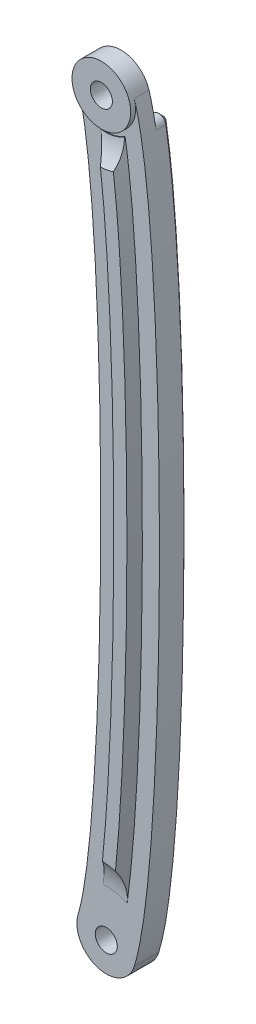
from build123d import *

# Parameters (mm, degrees)
BOSS_EXTRUDE1_DEPTH  = 6
BOSS_EXTRUDE2_DEPTH  = 2
BOSS_EXTRUDE2_TAPER  = 30
SKETCH6_R            = 6
BOSS_EXTRUDE3_DEPTH  = 1
SKETCH7_R            = 6
CUT_EXTRUDE1_DEPTH   = 3
FILLET1_START        = -1
FILLET1_DEPTH        = 4
CHAMFER1_SIZE        = 1
M4_CLEARANCE_HOLE1_D = 4.5


with BuildPart() as part:
    # Sketch1 → Boss-Extrude1 (new body)
    with BuildSketch(Plane.XY):
        with BuildLine():
            ThreePointArc((-5.731715344, -1.774102368), (-1.774102368, 5.731715344), (5.731715344, 1.774102368))
            add(Edge.make_bspline(
                [(5.731715344, 1.774102368), (5.862890335, 1.350306246), (6.10195439, 0.511836894), (6.5513215, -1.302172264), (7.055062132, -3.775725238), (7.600837363, -7.119895561), (8.261344969, -12.065805628), (8.9758633, -19.127681627), (9.671419516, -28.81644754), (10.210024516, -39.49120604), (10.721813898, -54.718080156), (10.977124068, -75), (10.721813898, -95.281919844), (10.210024516, -110.50879396), (9.671419516, -121.18355246), (8.9758633, -130.872318373), (8.261344969, -137.934194372), (7.600837363, -142.880104439), (7.055062132, -146.224274762), (6.5513215, -148.697827736), (6.10195439, -150.511836894), (5.862890335, -151.350306246), (5.731715344, -151.774102368)],
                knots=[0, 0, 0, 0, 0.015625, 0.03125, 0.0625, 0.09375, 0.125, 0.1875, 0.25, 0.3125, 0.375, 0.5, 0.625, 0.6875, 0.75, 0.8125, 0.875, 0.90625, 0.9375, 0.96875, 0.984375, 1, 1, 1, 1], degree=3))
            ThreePointArc((5.731715344, -151.774102368), (-1.774102368, -155.731715344), (-5.731715344, -148.225897632))
            add(Edge.make_bspline(
                [(-5.731715344, -1.774102368), (-5.692087495, -1.902130803), (-5.618775496, -2.148725819), (-5.458728189, -2.727966614), (-5.255155063, -3.54817606), (-5.006643591, -4.688807627), (-4.677115643, -6.39564749), (-4.27454567, -8.85601244), (-3.817957958, -12.269624912), (-3.392734432, -16.09709888), (-2.871156001, -21.69677536), (-2.308115125, -29.531273979), (-1.780341203, -39.985350621), (-1.402466695, -51.223362083), (-1.175470707, -62.981825406), (-1.099764647, -75), (-1.175470707, -87.018174594), (-1.402466695, -98.776637917), (-1.780341203, -110.014649379), (-2.308115125, -120.468726021), (-2.871156001, -128.30322464), (-3.392734432, -133.90290112), (-3.817957958, -137.730375088), (-4.27454567, -141.14398756), (-4.677115643, -143.60435251), (-5.006643591, -145.311192373), (-5.255155063, -146.45182394), (-5.458728189, -147.272033386), (-5.618775496, -147.851274181), (-5.692087495, -148.097869197), (-5.731715344, -148.225897632)],
                knots=[0, 0, 0, 0, 0.0078125, 0.015625, 0.03125, 0.046875, 0.0625, 0.09375, 0.125, 0.15625, 0.1875, 0.25, 0.3125, 0.375, 0.4375, 0.5, 0.5625, 0.625, 0.6875, 0.75, 0.8125, 0.84375, 0.875, 0.90625, 0.9375, 0.953125, 0.96875, 0.984375, 0.9921875, 1, 1, 1, 1], degree=3))
        make_face()
    extrude(amount=BOSS_EXTRUDE1_DEPTH)

    # Sketch2 → Boss-Extrude2 (add)
    with BuildSketch(Plane.XY.offset(6)):
        with BuildLine():
            add(Edge.make_bspline(
                [(3.842779218, -144.149098541), (3.99518889, -143.228609095), (4.133577932, -142.306808915), (4.482341024, -139.816291581), (4.674300588, -138.24585293), (5.022834622, -135.101667614), (5.179034802, -133.527885959), (5.608568883, -128.802888823), (5.843693204, -125.648101279), (6.249577099, -119.332508984), (6.419662658, -116.171641222), (6.857535334, -106.68227104), (7.05432563, -100.34499664), (7.313633365, -87.672679841), (7.436364195, -75.000225736), (7.313637964, -62.327524864), (7.05431874, -49.65468667), (6.857549017, -43.318319211), (6.419745963, -33.830017305), (6.249687473, -30.669449522), (5.843863318, -24.354304808), (5.608771942, -21.1996664), (5.179285888, -16.474715495), (5.023101498, -14.900919175), (4.67459471, -11.756621418), (4.482646895, -10.186085829), (4.133804085, -7.694692501), (3.995316322, -6.772156482), (3.842779302, -5.850901403)],
                knots=[0.044109896, 0.044109896, 0.044109896, 0.044109896, 0.0625, 0.0625, 0.09375, 0.09375, 0.125, 0.125, 0.1875, 0.1875, 0.25, 0.25, 0.375, 0.375, 0.5, 0.625, 0.625, 0.75, 0.75, 0.8125, 0.8125, 0.875, 0.875, 0.90625, 0.90625, 0.9375, 0.9375, 0.955902495, 0.955902495, 0.955902495, 0.955902495], degree=3))
            ThreePointArc((3.842779302, -5.850901403), (1.496097545, -6.838252126), (-1.048489728, -6.921030941))
            add(Edge.make_bspline(
                [(-1.048489728, -6.921030941), (-0.887726028, -7.908676873), (-0.743269436, -8.898495118), (-0.400727329, -11.426505037), (-0.218072452, -12.966752267), (0.114129955, -16.051657047), (0.263395019, -17.596352224), (0.674511995, -22.235323757), (0.900378843, -25.335536499), (1.290535741, -31.537230608), (1.454172696, -34.639030666), (1.875705513, -43.946533714), (2.065405192, -50.154303756), (2.315616461, -62.573759578), (2.374993429, -68.785688578), (2.37500657, -81.21228644), (2.315647979, -87.424382498), (2.065406806, -99.845909639), (1.875647227, -106.055756994), (1.453897372, -115.3665461), (1.290239744, -118.467676771), (0.900441737, -124.663261276), (0.675011926, -127.757791041), (0.264495235, -132.3918521), (0.115436706, -133.935233344), (-0.216369082, -137.018395892), (-0.398831003, -138.558207687), (-0.741756199, -141.091163775), (-0.886846381, -142.085950818), (-1.048489537, -143.07896903)],
                knots=[0.042345585, 0.042345585, 0.042345585, 0.042345585, 0.0625, 0.0625, 0.09375, 0.09375, 0.125, 0.125, 0.1875, 0.1875, 0.25, 0.25, 0.375, 0.375, 0.5, 0.5, 0.625, 0.625, 0.75, 0.75, 0.8125, 0.8125, 0.875, 0.875, 0.90625, 0.90625, 0.9375, 0.9375, 0.957747168, 0.957747168, 0.957747168, 0.957747168], degree=3))
            ThreePointArc((-1.048489537, -143.07896903), (1.49609759, -143.161747884), (3.842779218, -144.149098541))
        make_face()
    extrude(amount=BOSS_EXTRUDE2_DEPTH, taper=BOSS_EXTRUDE2_TAPER)

    # Sketch5 → Cut-Revolve1 (revolve, cut)
    with BuildSketch(Plane(origin=(0, 0, 0), x_dir=(0, 0, -1), z_dir=(1, 0, 0))):
        with BuildLine():
            ThreePointArc((-6, -140.397478747), (-6.513167019, -137.235201087), (-8, -134.397478747))
            Line((-8, -134.397478747), (-8, -142.397478747))
            Line((-8, -142.397478747), (-6, -144.149098541))
            Line((-6, -144.149098541), (-6, -140.397478747))
        make_face()
    revolve(axis=Axis((0, -150, 0), (0, 0, 1)), mode=Mode.SUBTRACT)

    # Sketch5<4> → Cut-Revolve2 (revolve, cut)
    with BuildSketch(Plane(origin=(0, 0, 0), x_dir=(0, 0, -1), z_dir=(1, 0, 0))):
        with BuildLine():
            Line((-8, -7.602521037), (-6, -5.850901403))
            ThreePointArc((-6, -5.850901403), (-6.513167019, -9.013179064), (-8, -11.850901403))
            Line((-8, -11.850901403), (-8, -7.602521037))
        make_face()
    revolve(axis=Axis((0, 0, 0), (0, 0, 1)), mode=Mode.SUBTRACT)

    # Sketch6 → Boss-Extrude3 (add)
    with BuildSketch(Plane.XY.offset(6)):
        with Locations(Location((0, 0, 0), (0, 0, 197.19854122))):
            Circle(SKETCH6_R)
    extrude(amount=BOSS_EXTRUDE3_DEPTH)

    # Sketch7 → Cut-Extrude1 (cut)
    with BuildSketch(Plane(origin=(0, 0, 0), x_dir=(-1, 0, 0), z_dir=(0, 0, -1))):
        with Locations(Location((0, 0, 0), (0, 0, 342.80145878))):
            Circle(SKETCH7_R)
    extrude(amount=-CUT_EXTRUDE1_DEPTH, mode=Mode.SUBTRACT)

    # Fillet1: read off the stored shape, not the designer's step
    # Fillet1 outline → Fillet1 (cut)
    with BuildSketch(Plane.XY.offset(FILLET1_START)):
        with BuildLine():
            add(Edge.make_bspline(
                [(-5.731715344, -1.774102368), (-5.692087495, -1.902130803), (-5.618775496, -2.148725819), (-5.458728189, -2.727966614), (-5.255155063, -3.54817606), (-5.006643591, -4.688807627), (-4.777507184, -5.875654311), (-4.632728696, -6.704930928), (-4.56971799, -7.081374578)],
                knots=[0, 0, 0, 0, 0.0078125, 0.015625, 0.03125, 0.046875, 0.0625, 0.074709213, 0.074709213, 0.074709213, 0.074709213], degree=3))
            ThreePointArc((-4.56971799, -7.081374578), (-4.005198612, -5.645063514), (-2.472239677, -5.466994694))
            ThreePointArc((-2.472239677, -5.466994694), (-4.498397818, -3.970442931), (-5.731715344, -1.774102368))
        make_face()
        with BuildLine():
            ThreePointArc((5.731715344, 1.774102368), (5.876589294, -1.210660261), (4.563775855, -3.895118733))
            ThreePointArc((4.563775855, -3.895118733), (6.101473007, -3.422320762), (7.182806929, -4.613440991))
            add(Edge.make_bspline(
                [(5.731715344, 1.774102368), (5.862890335, 1.350306246), (6.10195439, 0.511836894), (6.5513215, -1.302172264), (6.902345222, -3.025828681), (7.137523842, -4.351431198), (7.182806929, -4.613440991)],
                knots=[0, 0, 0, 0, 0.015625, 0.03125, 0.0625, 0.070065175, 0.070065175, 0.070065175, 0.070065175], degree=3))
        make_face()
    extrude(amount=FILLET1_DEPTH, mode=Mode.SUBTRACT)

    # Chamfer1
    chamfer1_edges = [part.edges().sort_by_distance(p)[0] for p in [
        (-1.128874241, -77.718314318, 0),
        (-1.774102368, -155.731715344, 0),
        (10.869440998, -78.27732173, 0),
        (-4.005198612, -5.645063514, 0),
        (1.308177895, -5.855652875, 0),
        (6.101473007, -3.422320762, 0),
    ]]
    chamfer(chamfer1_edges, length=CHAMFER1_SIZE)

    # M4 Clearance Hole1 (through all)
    with Locations(Plane.XY.offset(7)):
        with Locations((0, 0), (0, -150)):
            Hole(M4_CLEARANCE_HOLE1_D / 2)


solid = part.part
